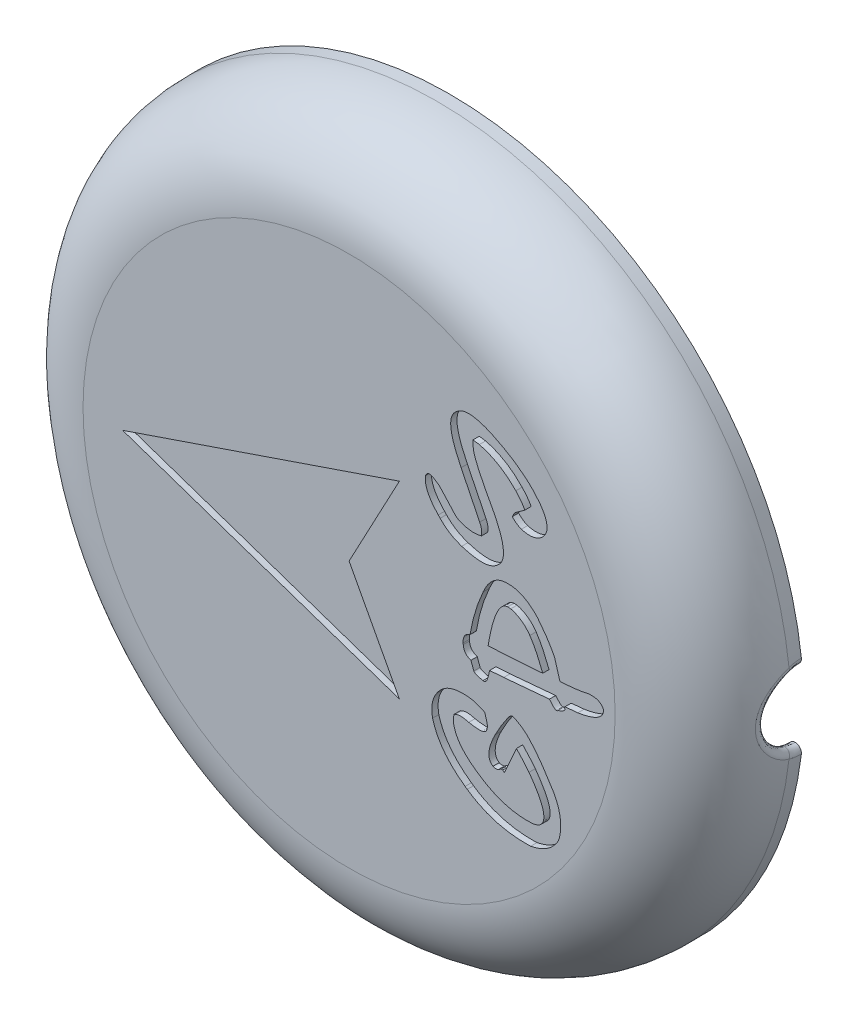
from build123d import *

# Parameters (mm, degrees)
CROQUIS3_R              = 27.152900398
SALIENTE_EXTRUIR1_DEPTH = 7
REDONDEO1_R             = 6
VACIADO1_T              = 1
SALIENTE_EXTRUIR3_REACH = 42.325
CROQUIS5_R              = 3
CROQUIS5_R_2            = 0.6
CROQUIS7_R              = 2.75
CORTAR_EXTRUIR1_DEPTH   = 5
REDONDEO4_R             = 0.5
REDONDEO5_R             = 0.5
CORTAR_EXTRUIR2_DEPTH   = 0.5
CORTAR_EXTRUIR3_DEPTH   = 0.5
CROQUIS5_4_R            = 3
CROQUIS5_4_R_2          = 0.6
CORTAR_EXTRUIR4_DEPTH   = 1.5
SALIENTE_EXTRUIR4_START = 1.5
CROQUIS10_R             = 1.25
CROQUIS10_R_2           = 0.6
SALIENTE_EXTRUIR4_DEPTH = 1.5


with BuildPart() as part:
    # Croquis3 → Saliente-Extruir1 (new body)
    with BuildSketch(Plane.XY):
        Circle(CROQUIS3_R)
    extrude(amount=SALIENTE_EXTRUIR1_DEPTH)

    # Redondeo1
    redondeo1_edges = [part.edges().sort_by_distance(p)[0] for p in [
        (-27.152900398, 0, 7),
    ]]
    fillet(redondeo1_edges, radius=REDONDEO1_R)

    # Vaciado1
    vaciado1_openings = [part.faces().sort_by_distance(p)[0] for p in [
        (0, 0, 0),
    ]]
    offset(amount=VACIADO1_T, openings=vaciado1_openings, kind=Kind.INTERSECTION)

    # Croquis5 → Saliente-Extruir3 (add, up to next)
    with BuildSketch(Plane.XY.offset(1.6), mode=Mode.PRIVATE) as saliente_extruir3_sk1:
        with Locations(Location((16.35, 16.35, 0), (0, 0, 178.900660574))):
            Circle(CROQUIS5_R)
        with Locations(Location((16.35, 16.35, 0), (0, 0, 45))):
            Circle(CROQUIS5_R_2, mode=Mode.SUBTRACT)
    saliente_extruir3_tool1 = extrude(saliente_extruir3_sk1.sketch, amount=SALIENTE_EXTRUIR3_REACH, mode=Mode.PRIVATE) - part.part
    # Croquis5 → Saliente-Extruir3 (add, up to next)
    with BuildSketch(Plane.XY.offset(1.6), mode=Mode.PRIVATE) as saliente_extruir3_sk2:
        with Locations(Location((-16.35, 16.35, 0), (0, 0, 268.900660574))):
            Circle(CROQUIS5_R)
        with Locations(Location((-16.35, 16.35, 0), (0, 0, 135))):
            Circle(CROQUIS5_R_2, mode=Mode.SUBTRACT)
    saliente_extruir3_tool2 = extrude(saliente_extruir3_sk2.sketch, amount=SALIENTE_EXTRUIR3_REACH, mode=Mode.PRIVATE) - part.part
    # Croquis5 → Saliente-Extruir3 (add, up to next)
    with BuildSketch(Plane.XY.offset(1.6), mode=Mode.PRIVATE) as saliente_extruir3_sk3:
        with Locations(Location((16.35, -16.35, 0), (0, 0, 181.099339427))):
            Circle(CROQUIS5_R)
        with Locations(Location((16.35, -16.35, 0), (0, 0, 315))):
            Circle(CROQUIS5_R_2, mode=Mode.SUBTRACT)
    saliente_extruir3_tool3 = extrude(saliente_extruir3_sk3.sketch, amount=SALIENTE_EXTRUIR3_REACH, mode=Mode.PRIVATE) - part.part
    # Croquis5 → Saliente-Extruir3 (add, up to next)
    with BuildSketch(Plane.XY.offset(1.6), mode=Mode.PRIVATE) as saliente_extruir3_sk4:
        with Locations(Location((-16.35, -16.35, 0), (0, 0, 91.099339414))):
            Circle(CROQUIS5_R)
        with Locations(Location((-16.35, -16.35, 0), (0, 0, 225))):
            Circle(CROQUIS5_R_2, mode=Mode.SUBTRACT)
    saliente_extruir3_tool4 = extrude(saliente_extruir3_sk4.sketch, amount=SALIENTE_EXTRUIR3_REACH, mode=Mode.PRIVATE) - part.part
    add(saliente_extruir3_tool1.solids().sort_by_distance((19.264611, 16.29407, 1.6))[0])
    add(saliente_extruir3_tool2.solids().sort_by_distance((-16.29407, 19.264611, 1.6))[0])
    add(saliente_extruir3_tool3.solids().sort_by_distance((19.264611, -16.29407, 1.6))[0])
    add(saliente_extruir3_tool4.solids().sort_by_distance((-16.29407, -19.264611, 1.6))[0])

    # Croquis7 → Cortar-Extruir1 (cut)
    with BuildSketch(Plane(origin=(28.155, 0, 0), x_dir=(0, 0, -1), z_dir=(1, 0, 0))):
        Circle(CROQUIS7_R)
    extrude(amount=-CORTAR_EXTRUIR1_DEPTH, mode=Mode.SUBTRACT)

    # Redondeo4
    redondeo4_edges = [part.edges().sort_by_distance(p)[0] for p in [
        (28.022887693, 2.702510914, 0.50885631),
        (28.022887709, -2.70251093, 0.508856313),
        (27.99363857, -1.551082345, 2.270824421),
    ]]
    fillet(redondeo4_edges, radius=REDONDEO4_R)

    # Redondeo5
    redondeo5_edges = [part.edges().sort_by_distance(p)[0] for p in [
        (27.018000822, -2.703263144, 0.50484497),
        (27.018000708, 2.703264115, 0.50483969),
        (26.972546732, -1.554776238, 2.268296898),
    ]]
    fillet(redondeo5_edges, radius=REDONDEO5_R - 0.0001)  # a hair under: the kernel refuses the full size

    # Croquis9 → Cortar-Extruir2 (cut)
    with BuildSketch(Plane.XY.offset(8)):
        Polygon((-18, 0), (4, -7.5), (0, 0), (4, 7.5), align=None)
    extrude(amount=-CORTAR_EXTRUIR2_DEPTH, mode=Mode.SUBTRACT)

    # Croquis8 → Cortar-Extruir3 (cut)
    # profile 1 of 3: a face of its own
    with BuildSketch(Plane.XY.offset(8)):
        with BuildLine():
            add(Edge.make_bspline(
                [(7.042410492, -5.513159488), (7.076445228, -5.466332309), (7.143630121, -5.373895013), (7.259658461, -5.248656922), (7.380538771, -5.131416134), (7.513131881, -5.027945791), (7.653298523, -4.93463834), (7.801492006, -4.850698572), (7.960461338, -4.782052577), (8.125834784, -4.719377383), (8.301278719, -4.672837185), (8.484273314, -4.63403671), (8.676483501, -4.608297579), (8.877260592, -4.594432763), (9.086674374, -4.589588141), (9.304258482, -4.597828599), (9.531197428, -4.614589751), (9.684500605, -4.6350915), (9.763020075, -4.645592173)],
                knots=[0, 0, 0, 0, 0.919870325, 1.815832753, 2.710997233, 3.595621929, 4.485983703, 5.387677116, 6.299713081, 7.237249249, 8.197658957, 9.182921507, 10.210984111, 11.278713495, 12.382478038, 13.540661213, 14.74036545, 16, 16, 16, 16], degree=3))
            add(Edge.make_bspline(
                [(9.763020075, -4.645592173), (9.823710929, -4.662434245), (9.94047014, -4.694835621), (10.10776735, -4.743677111), (10.259667605, -4.793324405), (10.395637448, -4.842248499), (10.516579336, -4.89074493), (10.622323697, -4.938053745), (10.713458651, -4.985215442), (10.766233363, -5.020703544), (10.790708875, -5.037161984)],
                knots=[0, 0, 0, 0, 1.368936314, 2.633608114, 3.787504055, 4.841671267, 5.773835003, 6.618691889, 7.359385928, 8, 8, 8, 8], degree=3))
            add(Edge.make_bspline(
                [(10.790708875, -5.037161984), (10.808065374, -5.091395189), (10.84096487, -5.194195021), (10.881832691, -5.341415779), (10.919866428, -5.470768153), (10.946717601, -5.584802516), (10.969178651, -5.682113761), (10.984492938, -5.763070733), (10.991025194, -5.827954034), (10.990400151, -5.865419864), (10.990132905, -5.881438902)],
                knots=[0, 0, 0, 0, 1.570116495, 2.976178742, 4.213157154, 5.287374441, 6.20607814, 6.96725387, 7.558435027, 8, 8, 8, 8], degree=3))
            add(Edge.make_bspline(
                [(10.990132905, -5.881438902), (10.989348816, -5.919409532), (10.987859833, -5.99151567), (10.967974175, -6.0920078), (10.940468894, -6.181348887), (10.909217113, -6.231309866), (10.894060015, -6.255540915)],
                knots=[0, 0, 0, 0, 1.160156224, 2.203133908, 3.128520873, 4, 4, 4, 4], degree=3))
            Line((10.894060015, -6.255540915), (10.880959166, -6.275920013))
            add(Edge.make_bspline(
                [(10.880959166, -6.275920013), (10.85984823, -6.299275809), (10.814381096, -6.349577751), (10.711756239, -6.397578613), (10.583240434, -6.427170929), (10.426273295, -6.444403819), (10.240212161, -6.441733982), (10.024313007, -6.427408064), (9.778593142, -6.394235705), (9.605677014, -6.362563956), (9.51410395, -6.345791206)],
                knots=[0, 0, 0, 0, 0.528750363, 1.138782434, 1.876137914, 2.76083782, 3.80436024, 5.023206366, 6.423547201, 8, 8, 8, 8], degree=3))
            add(Edge.make_bspline(
                [(9.51410395, -6.345791206), (9.455530057, -6.330223959), (9.342879845, -6.300284789), (9.178420562, -6.265559362), (9.025442854, -6.24734067), (8.88386552, -6.238351973), (8.753376378, -6.245332864), (8.634501831, -6.266156308), (8.52585909, -6.29625258), (8.4621449, -6.330540316), (8.431100456, -6.347246856)],
                knots=[0, 0, 0, 0, 1.309325813, 2.518115532, 3.627163281, 4.634830379, 5.579694326, 6.441351588, 7.240555783, 8, 8, 8, 8], degree=3))
            Line((8.431100456, -6.347246856), (8.358317963, -6.367625954))
            add(Edge.make_bspline(
                [(8.358317963, -6.367625954), (8.337385801, -6.439894474), (8.296086412, -6.582481072), (8.277785269, -6.805845722), (8.297629793, -7.030576135), (8.33983736, -7.176029955), (8.361229263, -7.249749768)],
                knots=[0, 0, 0, 0, 1.00343956, 1.979797467, 2.976108339, 4, 4, 4, 4], degree=3))
            add(Edge.make_bspline(
                [(8.361229263, -7.249749768), (8.390170132, -7.343209241), (8.44887327, -7.532780754), (8.578424773, -7.807680541), (8.741500396, -8.078269319), (8.938687892, -8.344604666), (9.171023852, -8.60602714), (9.436328146, -8.863751738), (9.737608042, -9.115745272), (9.955174806, -9.274364775), (10.067250896, -9.356075111)],
                knots=[0, 0, 0, 0, 0.84852098, 1.721124692, 2.629915237, 3.587829595, 4.59355424, 5.662964105, 6.796112794, 8, 8, 8, 8], degree=3))
            Line((10.067250896, -9.356075111), (10.23028368, -9.47107145))
            add(Edge.make_bspline(
                [(10.23028368, -9.47107145), (10.31771587, -9.530857777), (10.491169627, -9.649465841), (10.755456503, -9.81515201), (11.021813138, -9.967186919), (11.288875534, -10.106532423), (11.557515892, -10.234173645), (11.827871973, -10.347034791), (12.099508752, -10.448538389), (12.372943627, -10.534902647), (12.646960202, -10.611500732), (12.922425209, -10.674022505), (13.199284602, -10.723591218), (13.477616786, -10.760190963), (13.757456844, -10.782848482), (14.038618548, -10.795479591), (14.321366998, -10.792093213), (14.509928822, -10.780932127), (14.604511501, -10.775333722)],
                knots=[0, 0, 0, 0, 1.091122116, 2.164640145, 3.212479533, 4.249917677, 5.26732756, 6.275547227, 7.267236662, 8.253709136, 9.228767494, 10.197681627, 11.162538302, 12.125450666, 13.088544665, 14.054139151, 15.023955498, 16, 16, 16, 16], degree=3))
            add(Edge.make_bspline(
                [(14.604511501, -10.775333722), (14.646865545, -10.768755076), (14.728780759, -10.756031586), (14.845280545, -10.726197897), (14.952431234, -10.692162847), (15.047918956, -10.649587384), (15.134789976, -10.603031485), (15.209942287, -10.547922896), (15.275342895, -10.486041931), (15.311513982, -10.44002865), (15.32942513, -10.417243857)],
                knots=[0, 0, 0, 0, 1.237287988, 2.392987826, 3.469950241, 4.480288862, 5.408664864, 6.311295292, 7.163789541, 8, 8, 8, 8], degree=3))
            add(Edge.make_bspline(
                [(15.32942513, -10.417243857), (15.351883304, -10.381455645), (15.397170836, -10.309287717), (15.445457902, -10.188392428), (15.473761948, -10.056585167), (15.487040373, -9.914811399), (15.481177738, -9.762113108), (15.461372207, -9.598591839), (15.420162994, -9.425340411), (15.365120903, -9.241269343), (15.290703846, -9.047602087), (15.202718889, -8.841743265), (15.093213206, -8.626894357), (14.970193219, -8.399476078), (14.828057553, -8.162856574), (14.671136556, -7.914432136), (14.494066506, -7.65742964), (14.369000902, -7.4834047), (14.304647631, -7.393859103)],
                knots=[0, 0, 0, 0, 0.60329194, 1.216555016, 1.849441273, 2.525323475, 3.247181613, 4.03029134, 4.876904964, 5.78999131, 6.775806052, 7.841695854, 8.989729526, 10.22230432, 11.538305907, 12.935665856, 14.423228131, 16, 16, 16, 16], degree=3))
            add(Edge.make_bspline(
                [(14.304647631, -7.393859103), (14.27476154, -7.354885844), (14.212547999, -7.273755645), (14.111316252, -7.150139354), (14.001165627, -7.017740623), (13.880620179, -6.878629433), (13.750187356, -6.732429765), (13.610377691, -6.578185036), (13.461366633, -6.415705936), (13.35764533, -6.305872428), (13.304616179, -6.249718316)],
                knots=[0, 0, 0, 0, 0.775295231, 1.613923436, 2.522117482, 3.494221397, 4.519668937, 5.615138259, 6.780701826, 8, 8, 8, 8], degree=3))
            add(Edge.make_bspline(
                [(13.304616179, -6.249718316), (13.296250067, -6.267619098), (13.278036774, -6.306589671), (13.251052048, -6.371366916), (13.216993948, -6.445838928), (13.177575477, -6.530746961), (13.135745965, -6.627911194), (13.087803149, -6.734485175), (13.035259797, -6.852062935), (12.976263042, -6.979381898), (12.916596872, -7.119240793), (12.848752971, -7.268297598), (12.775405424, -7.42772958), (12.701242607, -7.59964442), (12.618388502, -7.780300166), (12.533110835, -7.972232587), (12.442673374, -8.175186323), (12.380320025, -8.313848377), (12.348254222, -8.385156656)],
                knots=[0, 0, 0, 0, 0.405305221, 0.882362396, 1.439243015, 2.085092002, 2.802665339, 3.609170777, 4.482388344, 5.444568398, 6.487584721, 7.601345959, 8.804071026, 10.087612608, 11.441917994, 12.881097681, 14.396074847, 16, 16, 16, 16], degree=3))
            Line((12.348254222, -8.385156656), (12.207056186, -8.286172466))
            add(Edge.make_bspline(
                [(12.207056186, -8.286172466), (12.189154748, -8.279980906), (12.146510797, -8.265231666), (12.06607268, -8.295381345), (11.968618532, -8.347481811), (11.899721142, -8.400299708), (11.86061152, -8.430281802)],
                knots=[0, 0, 0, 0, 0.566921875, 1.350494217, 2.496007335, 4, 4, 4, 4], degree=3))
            add(Edge.make_bspline(
                [(11.86061152, -8.430281802), (11.81621103, -8.441650704), (11.73497748, -8.462450842), (11.618926925, -8.468118454), (11.518856019, -8.457626531), (11.465071781, -8.428081413), (11.439928711, -8.414269654)],
                knots=[0, 0, 0, 0, 1.265420129, 2.315167469, 3.212374061, 4, 4, 4, 4], degree=3))
            Line((11.439928711, -8.414269654), (11.423916563, -8.402624455))
            add(Edge.make_bspline(
                [(11.423916563, -8.402624455), (11.396490321, -8.381613634), (11.342012414, -8.339878951), (11.273374785, -8.262594569), (11.215649167, -8.176235086), (11.172225947, -8.078525387), (11.140122475, -7.971980729), (11.121140413, -7.85503073), (11.116888747, -7.728669953), (11.120597484, -7.592327397), (11.138832984, -7.446305979), (11.170281814, -7.290525493), (11.212056119, -7.124538326), (11.268833726, -6.949270098), (11.335306191, -6.763615431), (11.414357574, -6.56788285), (11.506349855, -6.362843739), (11.573952195, -6.22382088), (11.608784095, -6.152189775)],
                knots=[0, 0, 0, 0, 0.67956167, 1.349842143, 2.026166502, 2.719450002, 3.448543705, 4.21416182, 5.047000675, 5.936799804, 6.899936225, 7.942671614, 9.067546333, 10.271238967, 11.571914737, 12.95346032, 14.430279682, 16, 16, 16, 16], degree=3))
            add(Edge.make_bspline(
                [(11.608784095, -6.152189775), (11.687984404, -6.005176738), (11.844233495, -5.715144366), (12.090238943, -5.294342001), (12.34342607, -4.893769618), (12.519255511, -4.636834395), (12.605904247, -4.510216736)],
                knots=[0, 0, 0, 0, 1.042414401, 2.056510956, 3.042248736, 4, 4, 4, 4], degree=3))
            add(Edge.make_bspline(
                [(12.605904247, -4.510216736), (12.629746393, -4.477388386), (12.674221174, -4.416150875), (12.742561799, -4.335128968), (12.807955758, -4.271500599), (12.870720712, -4.225031537), (12.931038624, -4.195646371), (12.988666011, -4.184710416), (13.044493832, -4.188952652), (13.075129748, -4.207993752), (13.09063565, -4.217631115)],
                knots=[0, 0, 0, 0, 1.56127764, 2.912383815, 4.074775322, 5.06475386, 5.908672324, 6.630282292, 7.306738267, 8, 8, 8, 8], degree=3))
            add(Edge.make_bspline(
                [(13.09063565, -4.217631115), (13.139519966, -4.238720359), (13.244049093, -4.283815402), (13.403167969, -4.372235446), (13.579807735, -4.47459671), (13.699958909, -4.553270321), (13.763145884, -4.594644428)],
                knots=[0, 0, 0, 0, 0.826998381, 1.768367139, 2.82639409, 4, 4, 4, 4], degree=3))
            add(Edge.make_bspline(
                [(13.763145884, -4.594644428), (13.805730268, -4.625706077), (13.894805357, -4.690678701), (14.025723285, -4.801429902), (14.161711901, -4.925704074), (14.301346697, -5.064311326), (14.445291996, -5.217443715), (14.593862592, -5.384489339), (14.744835056, -5.567694981), (14.902430265, -5.763207782), (15.061948923, -5.975549989), (15.228290792, -6.200219356), (15.396795975, -6.441066627), (15.569587418, -6.695636412), (15.747973379, -6.963957042), (15.929096805, -7.247105493), (16.114591797, -7.545269615), (16.238435016, -7.749400938), (16.301799235, -7.853844458)],
                knots=[0, 0, 0, 0, 0.60884533, 1.273540832, 1.979890273, 2.737073072, 3.5461305, 4.407915814, 5.319538986, 6.288780729, 7.309142928, 8.387842461, 9.518607123, 10.705051972, 11.942762771, 13.241320558, 14.588525324, 16, 16, 16, 16], degree=3))
            add(Edge.make_bspline(
                [(16.301799235, -7.853844458), (16.358878607, -7.966073919), (16.471162738, -8.186846978), (16.607124666, -8.528037274), (16.710579561, -8.869971795), (16.783057357, -9.213255137), (16.822409369, -9.557351361), (16.829492777, -9.902777215), (16.805628934, -10.249418922), (16.76485089, -10.478182053), (16.744316792, -10.59337749)],
                knots=[0, 0, 0, 0, 1.065790626, 2.096578348, 3.105247993, 4.08755554, 5.063552695, 6.033442107, 7.009724625, 8, 8, 8, 8], degree=3))
            add(Edge.make_bspline(
                [(16.744316792, -10.59337749), (16.734510594, -10.642279942), (16.714514536, -10.741998127), (16.657765221, -10.888117975), (16.585879418, -11.036351924), (16.52326639, -11.130224104), (16.491033717, -11.178548733)],
                knots=[0, 0, 0, 0, 0.929646259, 1.895664433, 2.916705291, 4, 4, 4, 4], degree=3))
            Line((16.491033717, -11.178548733), (16.45464247, -11.229496478))
            add(Edge.make_bspline(
                [(16.45464247, -11.229496478), (16.40013784, -11.302823436), (16.290909367, -11.449772264), (16.093448174, -11.644236204), (15.876576072, -11.823783515), (15.632447213, -11.980253565), (15.366820574, -12.120638375), (15.076771163, -12.241191994), (14.763316059, -12.343641436), (14.543828431, -12.394262703), (14.431289168, -12.420218061)],
                knots=[0, 0, 0, 0, 0.910643549, 1.824949607, 2.757541056, 3.716601727, 4.713079726, 5.75278387, 6.847770832, 8, 8, 8, 8], degree=3))
            add(Edge.make_bspline(
                [(14.431289168, -12.420218061), (14.311447174, -12.422959933), (14.073703434, -12.428399285), (13.719728618, -12.422419268), (13.371550638, -12.403791301), (13.029331605, -12.371257595), (12.692668315, -12.328274729), (12.362615397, -12.271042086), (12.03848676, -12.203115406), (11.721159397, -12.120960237), (11.409045181, -12.028359298), (11.103420957, -11.921501167), (10.802984923, -11.803835846), (10.50889175, -11.673135467), (10.221729256, -11.527748652), (9.939194252, -11.372960243), (9.663688257, -11.203730555), (9.48548778, -11.082222812), (9.396196311, -11.021338548)],
                knots=[0, 0, 0, 0, 1.081282931, 2.145059835, 3.192730694, 4.225844427, 5.245443307, 6.253600255, 7.246852489, 8.232038067, 9.209727475, 10.182869807, 11.151750269, 12.11971079, 13.084757342, 14.054507482, 15.025165997, 16, 16, 16, 16], degree=3))
            Line((9.396196311, -11.021338548), (9.225885278, -10.90197526))
            add(Edge.make_bspline(
                [(9.225885278, -10.90197526), (9.142595884, -10.841755211), (8.977743815, -10.722563568), (8.738873849, -10.53833004), (8.512447073, -10.34807382), (8.297596966, -10.154075296), (8.095224011, -9.954916692), (7.901788473, -9.754898017), (7.722991295, -9.547590918), (7.556003594, -9.336076039), (7.397632378, -9.122829091), (7.254035185, -8.903166344), (7.119176395, -8.681260184), (6.999118544, -8.45364248), (6.888617415, -8.222962476), (6.792487196, -7.987070274), (6.703165391, -7.748574157), (6.655665839, -7.585847713), (6.631917232, -7.504488493)],
                knots=[0, 0, 0, 0, 1.131052381, 2.238656295, 3.318891648, 4.38497875, 5.423385683, 6.443103518, 7.446259184, 8.434480757, 9.408505573, 10.368197908, 11.321510905, 12.265083384, 13.198996946, 14.135106161, 15.067598949, 16, 16, 16, 16], degree=3))
            add(Edge.make_bspline(
                [(6.631917232, -7.504488493), (6.617853067, -7.412954252), (6.590421093, -7.234417877), (6.574422781, -6.969487306), (6.580840938, -6.716039574), (6.611799346, -6.474324685), (6.663466566, -6.244131374), (6.740285647, -6.026444583), (6.836824722, -5.818681099), (6.920448848, -5.691754145), (6.96234975, -5.628155826)],
                knots=[0, 0, 0, 0, 1.135352578, 2.214490783, 3.250411305, 4.240265305, 5.198837425, 6.138000975, 7.067022381, 8, 8, 8, 8], degree=3))
            Line((6.96234975, -5.628155826), (7.042410492, -5.513159488))
        make_face()
    # profile 2 of 3: a face of its own
    with BuildSketch(Plane.XY.offset(8)):
        with BuildLine():
            add(Edge.make_bspline(
                [(9.069116422, -1.103119433), (9.067282913, -1.05310383), (9.063764766, -0.957133614), (9.080206685, -0.819017437), (9.112252206, -0.693310898), (9.166570286, -0.583291658), (9.233306243, -0.484084686), (9.321897356, -0.402185963), (9.426479779, -0.332365015), (9.505621821, -0.299260861), (9.546569576, -0.282132913)],
                knots=[0, 0, 0, 0, 1.165342612, 2.236065836, 3.232294042, 4.173490665, 5.083645309, 6.003939123, 6.967246617, 8, 8, 8, 8], degree=3))
            add(Edge.make_bspline(
                [(9.546569576, -0.282132913), (9.567933505, -0.282102535), (9.600029826, -0.282056896), (9.615601013, -0.255932733), (9.620807718, -0.247197317)],
                knots=[0, 0, 0, 0, 1.331238532, 2, 2, 2, 2], degree=3))
            add(Edge.make_bspline(
                [(9.620807718, -0.247197317), (9.646543559, -0.097572917), (9.697833587, 0.200619777), (9.791586039, 0.643875968), (9.899210044, 1.082304013), (10.021678356, 1.516294123), (10.158081859, 1.94565697), (10.310533784, 2.369413542), (10.473570823, 2.789217013), (10.595032508, 3.063879923), (10.655774767, 3.201237195)],
                knots=[0, 0, 0, 0, 1.009013487, 2.010904965, 3.010536026, 4.009037562, 5.007544307, 6.004153501, 7.001889149, 8, 8, 8, 8], degree=3))
            add(Edge.make_bspline(
                [(10.655774767, 3.201237195), (10.681940057, 3.261157384), (10.73329095, 3.378754219), (10.817583714, 3.547463226), (10.906763441, 3.705182101), (10.999305032, 3.852441696), (11.097517768, 3.98778735), (11.19749328, 4.113566988), (11.30233214, 4.228234635), (11.413609548, 4.328828379), (11.525533595, 4.422673763), (11.644320114, 4.502175551), (11.766097969, 4.572446405), (11.892449692, 4.630826501), (12.022148543, 4.679406075), (12.156662541, 4.715739091), (12.295539957, 4.740679447), (12.389851075, 4.748838555), (12.437490193, 4.752959944)],
                knots=[0, 0, 0, 0, 1.255806257, 2.464592401, 3.620665319, 4.735111077, 5.803430455, 6.831091006, 7.820463646, 8.783495738, 9.710774263, 10.623321153, 11.525046758, 12.409064946, 13.293770743, 14.18234664, 15.081853737, 16, 16, 16, 16], degree=3))
            Line((12.437490193, 4.752959944), (12.514639635, 4.757326893))
            add(Edge.make_bspline(
                [(12.514639635, 4.757326893), (12.621986724, 4.760268088), (12.835611799, 4.766121185), (13.155111426, 4.722334869), (13.47036371, 4.641129255), (13.780121344, 4.514807496), (14.086803686, 4.350985582), (14.386264608, 4.142990178), (14.684450922, 3.898115597), (14.869199756, 3.709185735), (14.964498345, 3.611730455)],
                knots=[0, 0, 0, 0, 0.920181362, 1.831198361, 2.756265244, 3.707280349, 4.694572969, 5.733977074, 6.831122316, 8, 8, 8, 8], degree=3))
            add(Edge.make_bspline(
                [(14.964498345, 3.611730455), (15.089015657, 3.458295333), (15.340986809, 3.147806582), (15.691231732, 2.650580671), (16.023839276, 2.122225191), (16.22695016, 1.752489243), (16.329897911, 1.565086756)],
                knots=[0, 0, 0, 0, 0.9618755, 1.946435187, 2.959140558, 4, 4, 4, 4], degree=3))
            Line((16.329897911, 1.565086756), (16.762225919, 0.086146501))
            add(Edge.make_bspline(
                [(16.762225919, 0.086146501), (16.884542619, 0.093841858), (17.120594711, 0.108692694), (17.46202728, 0.139176303), (17.779152478, 0.168282129), (18.071250439, 0.20346224), (18.338697939, 0.241161267), (18.580986215, 0.281452629), (18.799145716, 0.324500673), (18.935140222, 0.358337116), (18.99955975, 0.374365172)],
                knots=[0, 0, 0, 0, 1.30207481, 2.512800632, 3.641846663, 4.68541166, 5.638295883, 6.511239093, 7.294785663, 8, 8, 8, 8], degree=3))
            Line((18.99955975, 0.374365172), (19.164048184, 0.384554721))
            add(Edge.make_bspline(
                [(19.164048184, 0.384554721), (19.229058976, 0.386764371), (19.35296712, 0.390975882), (19.531146811, 0.377621411), (19.690952761, 0.342212152), (19.834966817, 0.290890219), (19.959957062, 0.216709213), (20.068390835, 0.125716977), (20.157922545, 0.014279982), (20.200541145, -0.071120715), (20.22230563, -0.11473318)],
                knots=[0, 0, 0, 0, 1.24494067, 2.372810454, 3.40962772, 4.370772529, 5.286867067, 6.176582626, 7.068816436, 8, 8, 8, 8], degree=3))
            add(Edge.make_bspline(
                [(20.22230563, -0.11473318), (20.222987962, -0.152638208), (20.224326035, -0.226971183), (20.206250373, -0.336723132), (20.170912354, -0.441479405), (20.117331274, -0.541031679), (20.048531478, -0.636203056), (19.962491049, -0.725814748), (19.859647171, -0.810346447), (19.73967215, -0.889808885), (19.60408992, -0.965610533), (19.451069145, -1.035610549), (19.281471838, -1.09995052), (19.095533346, -1.161403783), (18.893105578, -1.218251134), (18.673270592, -1.268201094), (18.436937173, -1.315245117), (18.27328762, -1.341424982), (18.188762779, -1.354946858)],
                knots=[0, 0, 0, 0, 0.701179677, 1.375035812, 2.048712068, 2.740319867, 3.461326993, 4.217931556, 5.035067252, 5.922589123, 6.880343946, 7.909937812, 9.036726305, 10.239103165, 11.536786491, 12.930070861, 14.414384478, 16, 16, 16, 16], degree=3))
            add(Edge.make_bspline(
                [(18.188762779, -1.354946858), (18.113043622, -1.359455115), (17.970267309, -1.367955899), (17.770026182, -1.385055237), (17.596578933, -1.398287309), (17.451053123, -1.41450189), (17.332525631, -1.430260584), (17.241058283, -1.445409791), (17.176034657, -1.460816524), (17.143970841, -1.475928164), (17.131960983, -1.481588396)],
                knots=[0, 0, 0, 0, 1.705162754, 3.215260959, 4.517905037, 5.615298811, 6.506968524, 7.2045781, 7.702065914, 8, 8, 8, 8], degree=3))
            Line((17.131960983, -1.481588396), (17.15816268, -1.670822877))
            add(Edge.make_bspline(
                [(17.15816268, -1.670822877), (17.131877664, -1.702872138), (17.075126432, -1.772068787), (16.950661073, -1.851541591), (16.795943989, -1.924722944), (16.677501156, -1.959335101), (16.613749634, -1.977964997)],
                knots=[0, 0, 0, 0, 0.777212027, 1.678056402, 2.750220386, 4, 4, 4, 4], degree=3))
            Line((16.613749634, -1.977964997), (16.55115669, -2.043469241))
            Line((16.55115669, -2.043469241), (16.472551597, -2.047836191))
            add(Edge.make_bspline(
                [(16.472551597, -2.047836191), (16.460663326, -2.046649832), (16.432162486, -2.043805665), (16.389006527, -2.015661184), (16.334240093, -1.97844215), (16.271229992, -1.922129321), (16.198534641, -1.850240494), (16.115681112, -1.76309423), (16.024141628, -1.659107973), (15.960517929, -1.584080751), (15.926682901, -1.54418134)],
                knots=[0, 0, 0, 0, 0.376356173, 0.90227305, 1.601768425, 2.501051751, 3.583932273, 4.864055489, 6.332307439, 8, 8, 8, 8], degree=3))
            add(Edge.make_bspline(
                [(15.926682901, -1.54418134), (15.817524865, -1.555976757), (15.587162765, -1.580869264), (15.223215066, -1.616992976), (14.82337744, -1.654670902), (14.387186256, -1.69423521), (13.915429647, -1.734028246), (13.407603901, -1.779074755), (12.863967966, -1.821391477), (12.489399897, -1.851706675), (12.296292156, -1.867335608)],
                knots=[0, 0, 0, 0, 0.72294318, 1.525666055, 2.408197237, 3.367376164, 4.409583498, 5.525552106, 6.724303856, 8, 8, 8, 8], degree=3))
            Line((12.296292156, -1.867335608), (11.169619167, -1.945940701))
            add(Edge.make_bspline(
                [(11.169619167, -1.945940701), (11.155994235, -2.019781428), (11.130364502, -2.15868253), (11.087844298, -2.351862174), (11.041560895, -2.515761359), (10.993657942, -2.650354247), (10.946554141, -2.758567266), (10.893596995, -2.8353606), (10.840121162, -2.891700558), (10.796353282, -2.90101075), (10.776593705, -2.905213957)],
                knots=[0, 0, 0, 0, 1.674100365, 3.149134545, 4.409312819, 5.466724148, 6.337946603, 7.022179682, 7.558550337, 8, 8, 8, 8], degree=3))
            Line((10.776593705, -2.905213957), (10.636851319, -2.913947856))
            add(Edge.make_bspline(
                [(10.636851319, -2.913947856), (10.581528369, -2.899442747), (10.477469365, -2.872159544), (10.331978431, -2.833217922), (10.209748316, -2.791379195), (10.108241175, -2.755113793), (10.029314653, -2.71723895), (9.971988696, -2.683057019), (9.931290632, -2.65065196), (9.922768906, -2.623816749), (9.919215939, -2.612628335)],
                knots=[0, 0, 0, 0, 1.724845916, 3.244327153, 4.539904761, 5.618814389, 6.495761832, 7.165807829, 7.652199961, 8, 8, 8, 8], degree=3))
            Line((9.919215939, -2.612628335), (9.687767612, -1.986698897))
            add(Edge.make_bspline(
                [(9.687767612, -1.986698897), (9.642096902, -1.969978605), (9.554145441, -1.937779103), (9.43496548, -1.87094976), (9.331070206, -1.794037774), (9.245451081, -1.701911896), (9.176196329, -1.5977954), (9.125192029, -1.480409566), (9.089382217, -1.351516252), (9.080807987, -1.260563763), (9.076394672, -1.213748822)],
                knots=[0, 0, 0, 0, 1.1044934, 2.127004552, 3.095888217, 4.032759658, 4.972356643, 5.925847656, 6.932395156, 8, 8, 8, 8], degree=3))
            Line((9.076394672, -1.213748822), (9.069116422, -1.103119433))
        make_face()
        with BuildLine():
            add(Edge.make_bspline(
                [(11.051711528, -0.311245911), (11.268136525, -0.29943128), (11.686476019, -0.276594148), (12.292320107, -0.23837621), (12.855362061, -0.20813551), (13.216278243, -0.185349863), (13.389485199, -0.174414824)],
                knots=[0, 0, 0, 0, 1.110674436, 2.146882241, 3.110671939, 4, 4, 4, 4], degree=3))
            add(Edge.make_bspline(
                [(13.389485199, -0.174414824), (13.460334396, -0.17016563), (13.598165762, -0.161899168), (13.799439468, -0.147866591), (13.989333259, -0.137869758), (14.167167801, -0.122669622), (14.33335783, -0.114639863), (14.487891833, -0.100791487), (14.631276067, -0.094161057), (14.762597093, -0.082509308), (14.882074273, -0.074773198), (14.989665811, -0.064967525), (15.085975586, -0.059395948), (15.170549746, -0.048420513), (15.244197783, -0.045071799), (15.305441527, -0.035559315), (15.355312485, -0.033067652), (15.384236884, -0.028100509), (15.396826353, -0.025938539)],
                knots=[0, 0, 0, 0, 1.692327795, 3.292286473, 4.810691592, 6.225984743, 7.547371913, 8.777208095, 9.924672916, 10.9690569, 11.920277818, 12.779217464, 13.544980979, 14.21958279, 14.81143041, 15.300773224, 15.69565856, 16, 16, 16, 16], degree=3))
            add(Edge.make_bspline(
                [(15.396826353, -0.025938539), (15.353533765, 0.084354947), (15.269314392, 0.298914731), (15.140203756, 0.609463371), (15.009554736, 0.899475802), (14.883174968, 1.171376382), (14.754382685, 1.422556586), (14.626679156, 1.653613098), (14.500359695, 1.865587247), (14.412816508, 1.997729365), (14.370593203, 2.061463357)],
                knots=[0, 0, 0, 0, 1.21997877, 2.373289601, 3.462397393, 4.494929459, 5.460181817, 6.368096256, 7.212909993, 8, 8, 8, 8], degree=3))
            add(Edge.make_bspline(
                [(14.370593203, 2.061463357), (14.321138054, 2.128724571), (14.223617173, 2.261357327), (14.061916992, 2.444048999), (13.887184463, 2.606398761), (13.702136175, 2.751363695), (13.504988366, 2.876823702), (13.296661864, 2.983211119), (13.078615898, 3.073706055), (12.926136362, 3.115943268), (12.849439102, 3.137188602)],
                knots=[0, 0, 0, 0, 1.051620978, 2.073697192, 3.068641667, 4.053162051, 5.031798737, 6.007987777, 6.998017149, 8, 8, 8, 8], degree=3))
            add(Edge.make_bspline(
                [(12.849439102, 3.137188602), (12.816989102, 3.142614752), (12.739407293, 3.15558765), (12.660804957, 3.150397453), (12.615079475, 3.147378151)],
                knots=[0, 0, 0, 0, 0.836536316, 2, 2, 2, 2], degree=3))
            Line((12.615079475, 3.147378151), (12.596156027, 3.147378151))
            add(Edge.make_bspline(
                [(12.596156027, 3.147378151), (12.554913969, 3.142540133), (12.471313256, 3.132733113), (12.351629124, 3.080462451), (12.235002612, 3.006729515), (12.12259782, 2.90552343), (12.013824077, 2.779471269), (11.908580066, 2.627439959), (11.807724174, 2.449766857), (11.710060829, 2.245764306), (11.616562864, 2.015931031), (11.524618499, 1.760060744), (11.436404851, 1.478360579), (11.352543942, 1.170281767), (11.270740082, 0.836981142), (11.194684175, 0.47746816), (11.119799502, 0.092249624), (11.074900831, -0.173823989), (11.051711528, -0.311245911)],
                knots=[0, 0, 0, 0, 0.499633011, 1.012793187, 1.561326221, 2.164038718, 2.833529184, 3.570846689, 4.396084806, 5.30140441, 6.303783124, 7.395029006, 8.588183665, 9.872056391, 11.255207972, 12.73736365, 14.314910862, 16, 16, 16, 16], degree=3))
        make_face(mode=Mode.SUBTRACT)
    # profile 3 of 3: a face of its own
    with BuildSketch(Plane.XY.offset(8)):
        with BuildLine():
            add(Edge.make_bspline(
                [(7.090593316, 6.719546322), (6.997934866, 6.820200586), (6.820508279, 7.012937921), (6.587805703, 7.310117068), (6.394453102, 7.59765746), (6.246727887, 7.879752609), (6.137641476, 8.152566417), (6.07026703, 8.417565771), (6.045500319, 8.676138331), (6.06400593, 8.842939526), (6.073094065, 8.924855856)],
                knots=[0, 0, 0, 0, 1.306091852, 2.500963718, 3.60110364, 4.610498938, 5.536402236, 6.40066423, 7.214563676, 8, 8, 8, 8], degree=3))
            add(Edge.make_bspline(
                [(6.073094065, 8.924855856), (6.090259514, 8.960585373), (6.122818113, 9.028355407), (6.169113863, 9.087556649), (6.191001704, 9.115545987)],
                knots=[0, 0, 0, 0, 1.054434106, 2, 2, 2, 2], degree=3))
            add(Edge.make_bspline(
                [(6.191001704, 9.115545987), (6.210495829, 9.131705867), (6.249706003, 9.164209594), (6.327580527, 9.184544593), (6.413955582, 9.187014325), (6.51115112, 9.167807558), (6.61870423, 9.128023602), (6.73716003, 9.06910766), (6.868010512, 8.991365299), (6.955254419, 8.928060207), (7.001798674, 8.894287209)],
                knots=[0, 0, 0, 0, 0.66630182, 1.340188919, 2.089375398, 2.955359952, 3.955729344, 5.133524937, 6.470747667, 8, 8, 8, 8], degree=3))
            add(Edge.make_bspline(
                [(7.001798674, 8.894287209), (7.020558464, 8.884097995), (7.068810366, 8.857890403), (7.146347946, 8.791511463), (7.24769303, 8.695341588), (7.321422725, 8.618579041), (7.362799839, 8.57549989)],
                knots=[0, 0, 0, 0, 0.528720217, 1.359917002, 2.51838509, 4, 4, 4, 4], degree=3))
            Line((7.362799839, 8.57549989), (8.413779036, 7.416802603))
            add(Edge.make_bspline(
                [(8.413779036, 7.416802603), (8.449254142, 7.382692704), (8.522538383, 7.312228697), (8.655016151, 7.224671244), (8.804998399, 7.143774391), (8.977190347, 7.076676962), (9.167752907, 7.017000034), (9.378944644, 6.967860234), (9.610357742, 6.92864448), (9.77226622, 6.911736643), (9.856328045, 6.902958204)],
                knots=[0, 0, 0, 0, 0.755050777, 1.559778957, 2.430636378, 3.371023468, 4.394785248, 5.498299971, 6.701133674, 8, 8, 8, 8], degree=3))
            add(Edge.make_bspline(
                [(9.856328045, 6.902958204), (9.903912544, 6.904893598), (10.004622382, 6.908989748), (10.162440462, 6.925816315), (10.335273601, 6.950713279), (10.454674029, 6.97287207), (10.51719308, 6.984474596)],
                knots=[0, 0, 0, 0, 0.857132455, 1.814071242, 2.855429642, 4, 4, 4, 4], degree=3))
            add(Edge.make_bspline(
                [(10.51719308, 6.984474596), (10.528902575, 7.057581305), (10.552341549, 7.203919491), (10.533646152, 7.428755217), (10.482464862, 7.655750235), (10.417042974, 7.799615713), (10.383273293, 7.873876658)],
                knots=[0, 0, 0, 0, 0.966639362, 1.934928442, 2.934044719, 4, 4, 4, 4], degree=3))
            add(Edge.make_bspline(
                [(10.383273293, 7.873876658), (10.343554806, 7.958336954), (10.258303334, 8.139621917), (10.120545211, 8.428587348), (9.962475021, 8.752300026), (9.786854691, 9.110888825), (9.593108603, 9.504570003), (9.380045833, 9.93275041), (9.149410561, 10.396540137), (8.987946625, 10.716839109), (8.904333038, 10.882704914)],
                knots=[0, 0, 0, 0, 0.668106882, 1.434019733, 2.291501339, 3.246822834, 4.292223605, 5.432362479, 6.670357062, 8, 8, 8, 8], degree=3))
            add(Edge.make_bspline(
                [(8.904333038, 10.882704914), (8.84994109, 10.994048359), (8.744361867, 11.210175095), (8.59941829, 11.52905439), (8.474605546, 11.834012439), (8.364510083, 12.123351645), (8.272716107, 12.39868012), (8.197148934, 12.65911964), (8.142694396, 12.905392789), (8.101215979, 13.135842597), (8.081630614, 13.352015132), (8.075190213, 13.553591967), (8.09047272, 13.740718515), (8.119611091, 13.913970698), (8.168923739, 14.072342769), (8.237466801, 14.214861399), (8.318998033, 14.345960673), (8.390037817, 14.418657726), (8.425424235, 14.454869664)],
                knots=[0, 0, 0, 0, 1.560984156, 3.02999797, 4.411391632, 5.71125845, 6.928972503, 8.066616153, 9.125386048, 10.105129065, 11.013788008, 11.857484906, 12.642243483, 13.374827744, 14.066895764, 14.723079157, 15.36393874, 16, 16, 16, 16], degree=3))
            Line((8.425424235, 14.454869664), (8.527319725, 14.552398205))
            add(Edge.make_bspline(
                [(8.527319725, 14.552398205), (8.5759375, 14.595003353), (8.673374919, 14.680390552), (8.845607816, 14.775921907), (9.034586752, 14.846455237), (9.2410328, 14.890673693), (9.46529553, 14.910908139), (9.70740281, 14.904051777), (9.967060783, 14.870041534), (10.245297036, 14.815078198), (10.54026649, 14.730210242), (10.853541403, 14.622083725), (11.185089744, 14.488417326), (11.534620046, 14.329862228), (11.90246791, 14.145442756), (12.287441488, 13.935361839), (12.691600661, 13.700912177), (12.963656906, 13.530848795), (13.103882877, 13.443193013)],
                knots=[0, 0, 0, 0, 0.619793425, 1.242160325, 1.879647653, 2.55287204, 3.264688628, 4.039015406, 4.875392584, 5.778959695, 6.762212297, 7.822538797, 8.962990886, 10.196440041, 11.510289755, 12.916718574, 14.410784016, 16, 16, 16, 16], degree=3))
            add(Edge.make_bspline(
                [(13.103882877, 13.443193013), (13.255330162, 13.337362316), (13.548184931, 13.13271669), (13.95568835, 12.813471146), (14.321005294, 12.498948246), (14.53897587, 12.279542255), (14.643960426, 12.173866337)],
                knots=[0, 0, 0, 0, 1.10883852, 2.14416949, 3.106147509, 4, 4, 4, 4], degree=3))
            add(Edge.make_bspline(
                [(14.643960426, 12.173866337), (14.697200481, 12.11693092), (14.801416611, 12.005481205), (14.948014659, 11.837000091), (15.08252839, 11.671964594), (15.205081925, 11.510770557), (15.314721714, 11.352128765), (15.410324294, 11.196058356), (15.495975169, 11.044849207), (15.566754925, 10.896048628), (15.627539914, 10.751781693), (15.674445858, 10.610190314), (15.7080322, 10.471330162), (15.729762326, 10.336050237), (15.741424636, 10.204048956), (15.735886337, 10.075351019), (15.720988779, 9.949868371), (15.70065008, 9.868921784), (15.690572674, 9.828814417)],
                knots=[0, 0, 0, 0, 1.396071218, 2.732775924, 3.999147989, 5.208907128, 6.358778082, 7.451357191, 8.486246159, 9.469680645, 10.400926629, 11.288614418, 12.138084838, 12.956767049, 13.74129388, 14.506521318, 15.260012054, 16, 16, 16, 16], degree=3))
            add(Edge.make_bspline(
                [(15.690572674, 9.828814417), (15.670777191, 9.780751645), (15.632007853, 9.686620981), (15.556719495, 9.556525773), (15.471236922, 9.438812759), (15.404657238, 9.370521628), (15.371785355, 9.336804765)],
                knots=[0, 0, 0, 0, 1.054535395, 2.065301522, 3.044795974, 4, 4, 4, 4], degree=3))
            add(Edge.make_bspline(
                [(15.371785355, 9.336804765), (15.31866593, 9.290570022), (15.213565747, 9.199091622), (15.035429503, 9.090632893), (14.843798937, 9.011327249), (14.639257634, 8.96023748), (14.42132559, 8.937364393), (14.190739958, 8.942785175), (13.946648232, 8.97504584), (13.782821388, 9.01675016), (13.697788019, 9.038396544)],
                knots=[0, 0, 0, 0, 0.945831133, 1.871387469, 2.789993405, 3.725366541, 4.696784501, 5.728017042, 6.820740472, 8, 8, 8, 8], degree=3))
            add(Edge.make_bspline(
                [(13.697788019, 9.038396544), (13.635695505, 9.063187753), (13.507679891, 9.114299579), (13.327506924, 9.231400543), (13.145204404, 9.372025031), (13.032775961, 9.484853283), (12.97433004, 9.543507045)],
                knots=[0, 0, 0, 0, 0.899559947, 1.854615179, 2.884721805, 4, 4, 4, 4], degree=3))
            add(Edge.make_bspline(
                [(12.97433004, 9.543507045), (12.99395039, 9.588045456), (13.030835707, 9.671775531), (13.093954487, 9.783686331), (13.155033874, 9.877809862), (13.202642593, 9.927886354), (13.224701815, 9.951089005)],
                knots=[0, 0, 0, 0, 1.212826118, 2.280054927, 3.203073476, 4, 4, 4, 4], degree=3))
            Line((13.224701815, 9.951089005), (13.974361492, 10.495502052))
            add(Edge.make_bspline(
                [(13.974361492, 10.495502052), (13.928673843, 10.577387067), (13.835212925, 10.744895113), (13.664592196, 10.98641045), (13.47171564, 11.22997316), (13.327652867, 11.386297763), (13.253814812, 11.466420507)],
                knots=[0, 0, 0, 0, 0.927341168, 1.897015061, 2.922134336, 4, 4, 4, 4], degree=3))
            add(Edge.make_bspline(
                [(13.253814812, 11.466420507), (13.149386626, 11.572154331), (12.942447633, 11.781680627), (12.611275575, 12.068352093), (12.26687699, 12.327133396), (11.909131489, 12.55692602), (11.540654382, 12.762614155), (11.157235086, 12.936326992), (10.762832992, 13.087641134), (10.490727813, 13.162518904), (10.354160296, 13.200099487)],
                knots=[0, 0, 0, 0, 1.041478672, 2.063835012, 3.067269618, 4.05889679, 5.042440292, 6.022654941, 7.00758557, 8, 8, 8, 8], degree=3))
            add(Edge.make_bspline(
                [(10.354160296, 13.200099487), (10.305160539, 13.207426288), (10.211572993, 13.22142018), (10.078232588, 13.240585213), (9.95887332, 13.255483056), (9.88400382, 13.262382578), (9.849049796, 13.265603731)],
                knots=[0, 0, 0, 0, 1.167050469, 2.229018999, 3.173189193, 4, 4, 4, 4], degree=3))
            add(Edge.make_bspline(
                [(9.849049796, 13.265603731), (9.847551534, 13.164126057), (9.844634498, 12.966554436), (9.87337852, 12.678502077), (9.925003884, 12.407597137), (9.982521714, 12.237875025), (10.01062693, 12.154942889)],
                knots=[0, 0, 0, 0, 1.077529372, 2.097892241, 3.070563892, 4, 4, 4, 4], degree=3))
            add(Edge.make_bspline(
                [(10.01062693, 12.154942889), (10.022386187, 12.118902383), (10.047537583, 12.041816813), (10.095903088, 11.921499648), (10.148012049, 11.785967957), (10.21411898, 11.639232027), (10.283990803, 11.47705296), (10.366748121, 11.303370706), (10.454581786, 11.114665151), (10.554579314, 10.914738287), (10.660401969, 10.699568514), (10.77685222, 10.472480586), (10.901105125, 10.231349936), (11.032890131, 9.976477183), (11.176290589, 9.709542863), (11.325892046, 9.427419896), (11.485884971, 9.133342721), (11.595328807, 8.932610499), (11.651144319, 8.830238615)],
                knots=[0, 0, 0, 0, 0.490242224, 1.048559136, 1.676763161, 2.368221274, 3.129762831, 3.960905291, 4.85651835, 5.822104397, 6.852236389, 7.958182612, 9.123125982, 10.361119846, 11.66956361, 13.042617155, 14.49175757, 16, 16, 16, 16], degree=3))
            add(Edge.make_bspline(
                [(11.651144319, 8.830238615), (11.694791794, 8.736318878), (11.779575708, 8.553882597), (11.895672465, 8.284093288), (11.993971741, 8.025311312), (12.079388727, 7.778490307), (12.149509213, 7.543575277), (12.203726441, 7.320017964), (12.243366127, 7.10868986), (12.269192844, 6.908958149), (12.277786115, 6.72058189), (12.273024408, 6.543716162), (12.251349368, 6.37883249), (12.214592671, 6.225734683), (12.164803162, 6.083585661), (12.095955431, 5.95449279), (12.015696433, 5.834520173), (11.948296188, 5.766569838), (11.914616943, 5.732615718)],
                knots=[0, 0, 0, 0, 1.506989752, 2.927282531, 4.272628259, 5.534160032, 6.727105481, 7.838493894, 8.879857277, 9.854558254, 10.766341704, 11.621123539, 12.425953567, 13.181158353, 13.90924165, 14.610327494, 15.305594208, 16, 16, 16, 16], degree=3))
            Line((11.914616943, 5.732615718), (11.822911002, 5.645276727))
            add(Edge.make_bspline(
                [(11.822911002, 5.645276727), (11.7870787, 5.613548965), (11.715250438, 5.549948532), (11.597185325, 5.466581182), (11.468354027, 5.39706163), (11.332001556, 5.334613867), (11.183953782, 5.287973144), (11.028011094, 5.249555493), (10.862443662, 5.223515562), (10.68728797, 5.209710215), (10.502598955, 5.205130941), (10.308651353, 5.212706654), (10.105715321, 5.232444453), (9.892901734, 5.261367323), (9.67046214, 5.302271041), (9.439141608, 5.355413927), (9.198086764, 5.417599349), (9.035650998, 5.467069786), (8.952369483, 5.492433492)],
                knots=[0, 0, 0, 0, 0.763287772, 1.530061699, 2.299293804, 3.096344171, 3.918927312, 4.771386718, 5.657220865, 6.58943747, 7.572899708, 8.60326484, 9.684048457, 10.824883229, 12.029025205, 13.291102087, 14.611136418, 16, 16, 16, 16], degree=3))
            add(Edge.make_bspline(
                [(8.952369483, 5.492433492), (8.869549851, 5.521632307), (8.705118284, 5.579604154), (8.466106917, 5.681514931), (8.237250744, 5.797313929), (8.016821303, 5.92343849), (7.806804519, 6.063602368), (7.606967764, 6.216768249), (7.417169435, 6.382977797), (7.298555834, 6.502429557), (7.239069601, 6.562336137)],
                knots=[0, 0, 0, 0, 1.032669517, 2.050280384, 3.053288497, 4.047818496, 5.035480634, 6.020534316, 7.007272726, 8, 8, 8, 8], degree=3))
            Line((7.239069601, 6.562336137), (7.090593316, 6.719546322))
        make_face()
    extrude(amount=-CORTAR_EXTRUIR3_DEPTH, mode=Mode.SUBTRACT)

    # Croquis5<4> → Cortar-Extruir4 (cut)
    # profile 1 of 4: a face of its own
    with BuildSketch(Plane.XY.offset(1.6)):
        with Locations(Location((16.35, 16.35, 0), (0, 0, 178.900660574))):
            Circle(CROQUIS5_4_R)
        with Locations(Location((16.35, 16.35, 0), (0, 0, 45))):
            Circle(CROQUIS5_4_R_2, mode=Mode.SUBTRACT)
    # profile 2 of 4: a face of its own
    with BuildSketch(Plane.XY.offset(1.6)):
        with Locations(Location((-16.35, 16.35, 0), (0, 0, 268.900660574))):
            Circle(CROQUIS5_4_R)
        with Locations(Location((-16.35, 16.35, 0), (0, 0, 135))):
            Circle(CROQUIS5_4_R_2, mode=Mode.SUBTRACT)
    # profile 3 of 4: a face of its own
    with BuildSketch(Plane.XY.offset(1.6)):
        with Locations(Location((16.35, -16.35, 0), (0, 0, 181.099339427))):
            Circle(CROQUIS5_4_R)
        with Locations(Location((16.35, -16.35, 0), (0, 0, 315))):
            Circle(CROQUIS5_4_R_2, mode=Mode.SUBTRACT)
    # profile 4 of 4: a face of its own
    with BuildSketch(Plane.XY.offset(1.6)):
        with Locations(Location((-16.35, -16.35, 0), (0, 0, 91.099339414))):
            Circle(CROQUIS5_4_R)
        with Locations(Location((-16.35, -16.35, 0), (0, 0, 225))):
            Circle(CROQUIS5_4_R_2, mode=Mode.SUBTRACT)
    extrude(amount=CORTAR_EXTRUIR4_DEPTH, mode=Mode.SUBTRACT)

    # Croquis10 → Saliente-Extruir4 (add)
    # profile 1 of 4: a face of its own
    with BuildSketch(Plane(origin=(0, 0, 3.1), x_dir=(-1, 0, 0), z_dir=(0, 0, -1)).offset(SALIENTE_EXTRUIR4_START)):
        with Locations(Location((16.35, 16.35, 0), (0, 0, 180))):
            Circle(CROQUIS10_R)
        with Locations((16.35, 16.35)):
            Circle(CROQUIS10_R_2, mode=Mode.SUBTRACT)
    # profile 2 of 4: a face of its own
    with BuildSketch(Plane(origin=(0, 0, 3.1), x_dir=(-1, 0, 0), z_dir=(0, 0, -1)).offset(SALIENTE_EXTRUIR4_START)):
        with Locations(Location((-16.35, 16.35, 0), (0, 0, 180))):
            Circle(CROQUIS10_R)
        with Locations((-16.35, 16.35)):
            Circle(CROQUIS10_R_2, mode=Mode.SUBTRACT)
    # profile 3 of 4: a face of its own
    with BuildSketch(Plane(origin=(0, 0, 3.1), x_dir=(-1, 0, 0), z_dir=(0, 0, -1)).offset(SALIENTE_EXTRUIR4_START)):
        with Locations(Location((-16.35, -16.35, 0), (0, 0, 180))):
            Circle(CROQUIS10_R)
        with Locations((-16.35, -16.35)):
            Circle(CROQUIS10_R_2, mode=Mode.SUBTRACT)
    # profile 4 of 4: a face of its own
    with BuildSketch(Plane(origin=(0, 0, 3.1), x_dir=(-1, 0, 0), z_dir=(0, 0, -1)).offset(SALIENTE_EXTRUIR4_START)):
        with Locations(Location((16.35, -16.35, 0), (0, 0, 180))):
            Circle(CROQUIS10_R)
        with Locations((16.35, -16.35)):
            Circle(CROQUIS10_R_2, mode=Mode.SUBTRACT)
    extrude(amount=-SALIENTE_EXTRUIR4_DEPTH)


solid = part.part
